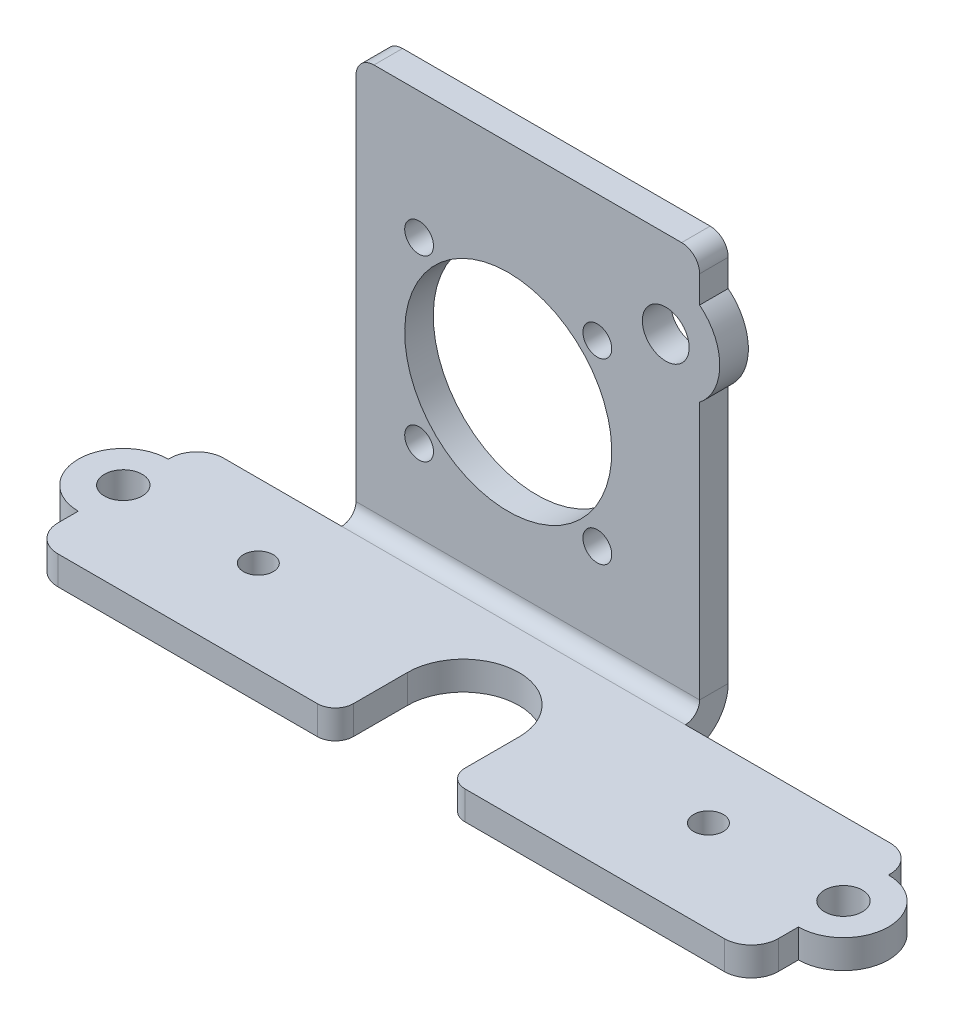
from build123d import *

# Parameters (mm, degrees)
BASE_FLANGE1_DEPTH         = 3.175
F_4_2_4_2_DIAMETER_HOLE1_D = 4.2
F_3_3_3_3_DIAMETER_HOLE1_D = 3.3
EDGE_FLANGE1_DEPTH         = 38.176085753
EDGE_FLANGE1_START         = 3.175
EDGE_FLANGE1_PROFILE_R     = 1.6
EDGE_FLANGE1_PROFILE_R_2   = 11.5
EDGE_FLANGE1_PROFILE_R_3   = 2.6
EDGE_FLANGE1_FLAT_DEPTH    = 3.175


# Sheet-metal steps are written as plain solids
with BuildPart() as part:
    # Sketch11 → Base-Flange1 (new body)
    with BuildSketch(Plane.XZ.offset(2.7625)):
        with BuildLine():
            Line((36.2, 21.175), (36.2, 15.175))
            ThreePointArc((36.2, 15.175), (30, 8.975), (23.8, 15.175))
            Line((23.8, 15.175), (23.8, 21.175))
            ThreePointArc((23.8, 21.175), (23.214213562, 22.589213562), (21.8, 23.175))
            Line((21.8, 23.175), (-7, 23.175))
            ThreePointArc((-7, 23.175), (-9.121320344, 22.296320344), (-10, 20.175))
            Line((-10, 20.175), (-10, 17.93389))
            ThreePointArc((-10, 17.93389), (-15, 12.93389), (-10, 7.93389))
            Line((-10, 7.93389), (-10, 7.7625))
            ThreePointArc((-10, 7.7625), (-9.121320344, 5.641179656), (-7, 4.7625))
            Line((-7, 4.7625), (67, 4.7625))
            ThreePointArc((67, 4.7625), (69.121320344, 5.641179656), (70, 7.7625))
            Line((70, 7.7625), (70, 7.93389))
            ThreePointArc((70, 7.93389), (75, 12.93389), (70, 17.93389))
            Line((70, 17.93389), (70, 20.175))
            ThreePointArc((70, 20.175), (69.121320344, 22.296320344), (67, 23.175))
            Line((67, 23.175), (38.2, 23.175))
            ThreePointArc((38.2, 23.175), (36.785786438, 22.589213562), (36.2, 21.175))
        make_face()
    extrude(amount=-BASE_FLANGE1_DEPTH)

    # Ø4.2 (4.2) Diameter Hole1 (through all)
    with Locations(Plane(origin=(0, -2.7625, 0), x_dir=(-1, 0, 0), z_dir=(0, -1, 0))):
        with Locations((-70, -12.93389), (10, -12.93389)):
            Hole(F_4_2_4_2_DIAMETER_HOLE1_D / 2)

    # Ø3.3 (3.3) Diameter Hole1 (through all)
    with Locations(Plane(origin=(0, 0.4125, 0), x_dir=(1, 0, 0), z_dir=(0, 1, 0))):
        with Locations((5, -12.93389), (55, -12.93389)):
            Hole(F_3_3_3_3_DIAMETER_HOLE1_D / 2)

    # Edge-Flange1 bend section (across the edge) → Edge-Flange1 (add)
    with BuildSketch(Plane(origin=(44.262809753, 0.4125, 3.175), x_dir=(0, 0, 1), z_dir=(-1, 0, 0))):
        with BuildLine():
            Line((-3.175, 1.5875), (0, 1.5875))
            ThreePointArc((0, 1.5875), (0.464967985, 0.464967985), (1.5875, 0))
            Line((1.5875, 0), (1.5875, -3.175))
            ThreePointArc((1.5875, -3.175), (-1.780096045, -1.780096045), (-3.175, 1.5875))
        make_face()
    extrude(amount=EDGE_FLANGE1_DEPTH)

    # Edge-Flange1 profile (on flange) → Edge-Flange1 flat (add)
    with BuildSketch(Plane(origin=(0, 0.4125, 3.175), x_dir=(-1, 0, 0), z_dir=(0, 0, -1)).offset(EDGE_FLANGE1_START)):
        with BuildLine():
            ThreePointArc((-6.086724, 42.5875), (-6.672510438, 44.001713562), (-8.086724, 44.5875))
            Line((-8.086724, 44.5875), (-42.262809753, 44.5875))
            ThreePointArc((-42.262809753, 44.5875), (-43.677023316, 44.001713562), (-44.262809753, 42.5875))
            Line((-44.262809753, 42.5875), (-44.262809753, 39.575887728))
            ThreePointArc((-44.262809753, 39.575887728), (-46.5, 34.902424049), (-44.262809753, 30.22896037))
            Line((-44.262809753, 30.22896037), (-44.262809753, 1.5875))
            Line((-44.262809753, 1.5875), (-6.086724, 1.5875))
            Line((-6.086724, 1.5875), (-6.086724, 42.5875))
        make_face()
        with Locations((-13.100505063, 10.688005063)):
            Circle(EDGE_FLANGE1_PROFILE_R, mode=Mode.SUBTRACT)
        with Locations((-23, 20.5875)):
            Circle(EDGE_FLANGE1_PROFILE_R_2, mode=Mode.SUBTRACT)
        with Locations((-32.899494937, 10.688005063)):
            Circle(EDGE_FLANGE1_PROFILE_R, mode=Mode.SUBTRACT)
        with Locations((-13.100505063, 30.486994937)):
            Circle(EDGE_FLANGE1_PROFILE_R, mode=Mode.SUBTRACT)
        with Locations((-32.899494937, 30.486994937)):
            Circle(EDGE_FLANGE1_PROFILE_R, mode=Mode.SUBTRACT)
        with Locations((-40.5, 34.902424049)):
            Circle(EDGE_FLANGE1_PROFILE_R_3, mode=Mode.SUBTRACT)
    extrude(amount=-EDGE_FLANGE1_FLAT_DEPTH)


solid = part.part
